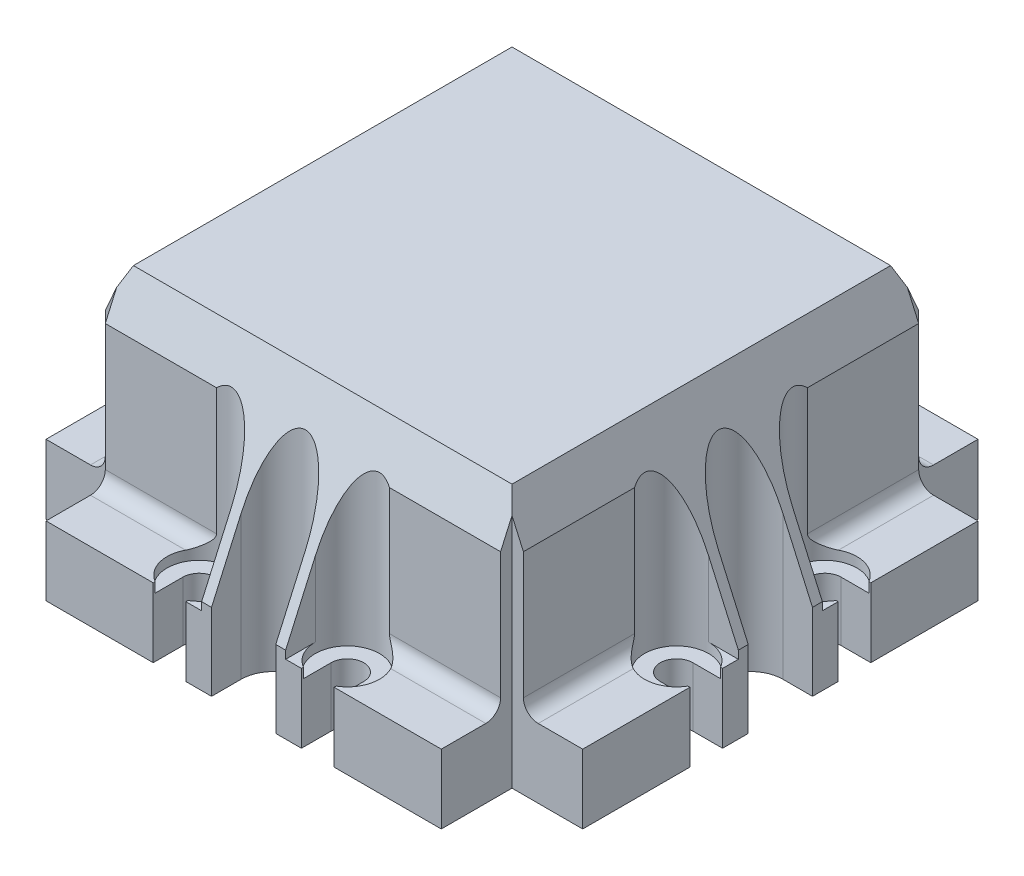
from build123d import *

# Parameters (mm, degrees)
SKETCH1_W            = 40
SKETCH1_H            = 28.8
BOSS_EXTRUDE1_DEPTH  = 11
CHAMFER2_SIZE        = 8
CHAMFER2_SIZE2       = 18
SKETCH10_W           = 13.5
SKETCH10_H           = 18.8
CUT_EXTRUDE7_DEPTH   = 6
FILLET1_R            = 1.5
SKETCH11_W           = 40
SKETCH11_H           = 3
CUT_EXTRUDE8_DEPTH   = 8
CUT_EXTRUDE9_REACH   = 38.748
CUT_EXTRUDE10_DEPTH  = 30.57093174
CUT_EXTRUDE2_DEPTH   = 30
SKETCH15_R           = 3.25
CUT_EXTRUDE12_DEPTH  = 1
CRVPATTERN15_ANGLE   = 90
CRVPATTERN15_2_ANGLE = 90
CRVPATTERN15_3_ANGLE = 180
CUT_EXTRUDE17_DEPTH  = 71.205905928
CUT_EXTRUDE18_DEPTH  = 62.566827448
CUT_EXTRUDE19_DEPTH  = 62.566810271
CUT_EXTRUDE20_DEPTH  = 71.20590591
SKETCH32_W           = 149.475413632
SKETCH32_H           = 198.109954942
CUT_EXTRUDE21_DEPTH  = 3
SKETCH34_W           = 32.310599212
SKETCH34_H           = 32.310599212
BOSS_EXTRUDE4_DEPTH  = 25.8


with BuildPart() as part:
    # Sketch1 → Boss-Extrude1 (new body)
    with BuildSketch(Plane.XY):
        with Locations((0, 14.4)):
            Rectangle(SKETCH1_W, SKETCH1_H)
    extrude(amount=BOSS_EXTRUDE1_DEPTH)

    # Chamfer2
    chamfer2_edges = [part.edges().sort_by_distance(p)[0] for p in [
        (0, 28.8, 11),
    ]]
    chamfer2_side = [part.faces().sort_by_distance(p)[0] for p in [
        (0, 28.8, 5.5),
    ]]
    chamfer(chamfer2_edges, length=CHAMFER2_SIZE, length2=CHAMFER2_SIZE2, reference=chamfer2_side[0])

    # Sketch10 → Cut-Extrude7 (cut)
    with BuildSketch(Plane.XY.offset(11)):
        with Locations((-13.25, 19.4)):
            Rectangle(SKETCH10_W, SKETCH10_H)
        with Locations((13.25, 19.4)):
            Rectangle(SKETCH10_W, SKETCH10_H)
    extrude(amount=-CUT_EXTRUDE7_DEPTH, mode=Mode.SUBTRACT)

    # Fillet1
    fillet1_edges = [part.edges().sort_by_distance(p)[0] for p in [
        (-13.25, 10, 5),
        (13.25, 10, 5),
    ]]
    fillet(fillet1_edges, radius=FILLET1_R)

    # Sketch11 → Cut-Extrude8 (cut)
    with BuildSketch(Plane.XY.offset(11)):
        with Locations((0, 1.5)):
            Rectangle(SKETCH11_W, SKETCH11_H)
    extrude(amount=-CUT_EXTRUDE8_DEPTH, mode=Mode.SUBTRACT)

    # Cut-Extrude9: up to this face of the body (flat: up to its plane)
    cut_extrude9_end = Plane(part.part.faces().sort_by_distance((-13.25, 10, 8.75))[0])
    # Sketch12 → Cut-Extrude9 (cut, up to the picked face)
    with BuildSketch(Plane(origin=(0, 28.8, 0), x_dir=(1, 0, 0), z_dir=(0, 1, 0)), mode=Mode.PRIVATE) as cut_extrude9_sk1:
        with BuildLine():
            Line((-4.25, -8), (-4.25, -11))
            Line((-4.25, -11), (-10.75, -11))
            Line((-10.75, -11), (-10.75, -8))
            ThreePointArc((-10.75, -8), (-7.5, -4.75), (-4.25, -8))
        make_face()
    cut_extrude9_tool1 = split(extrude(cut_extrude9_sk1.sketch, amount=-CUT_EXTRUDE9_REACH, mode=Mode.PRIVATE), bisect_by=cut_extrude9_end, keep=Keep.BOTH, mode=Mode.PRIVATE)
    cut_extrude9 = cut_extrude9_tool1.solids().sort_by(Axis((-7.5, 28.8, 8.176346), (0, -1, 0)))[0]
    add(cut_extrude9, mode=Mode.SUBTRACT)

    # Sketch13 → Cut-Extrude10 (cut, through all)
    with BuildSketch(Plane(origin=(0, 10, 0), x_dir=(1, 0, 0), z_dir=(0, 1, 0))):
        with BuildLine():
            Line((-9.15, -8), (-9.15, -11))
            Line((-9.15, -11), (-5.85, -11))
            Line((-5.85, -11), (-5.85, -8))
            ThreePointArc((-5.85, -8), (-7.5, -6.35), (-9.15, -8))
        make_face()
    cut_extrude10 = extrude(amount=-CUT_EXTRUDE10_DEPTH, mode=Mode.SUBTRACT)

    # Sketch3 → Cut-Extrude2 (cut)
    with BuildSketch(Plane.XZ):
        with BuildLine():
            Line((-3.25, 8), (-3.25, 11))
            Line((-3.25, 11), (3.25, 11))
            Line((3.25, 11), (3.25, 8))
            ThreePointArc((3.25, 8), (0, 4.75), (-3.25, 8))
        make_face()
    extrude(amount=-CUT_EXTRUDE2_DEPTH, mode=Mode.SUBTRACT)

    # Sketch15 → Cut-Extrude12 (cut)
    with BuildSketch(Plane(origin=(0, 10, 0), x_dir=(1, 0, 0), z_dir=(0, 1, 0))):
        with Locations((-7.5, -8)):
            Circle(SKETCH15_R)
    cut_extrude12 = extrude(amount=-CUT_EXTRUDE12_DEPTH, mode=Mode.SUBTRACT)

    # Mirror1: Cut-Extrude9, Cut-Extrude10, Cut-Extrude12 across plane
    add(cut_extrude9.mirror(Plane(origin=(0, 0, 0), x_dir=(0, 0, 1), z_dir=(1, 0, 0))), mode=Mode.SUBTRACT)
    add(cut_extrude10.mirror(Plane(origin=(0, 0, 0), x_dir=(0, 0, 1), z_dir=(1, 0, 0))), mode=Mode.SUBTRACT)
    add(cut_extrude12.mirror(Plane(origin=(0, 0, 0), x_dir=(0, 0, 1), z_dir=(1, 0, 0))), mode=Mode.SUBTRACT)


with BuildPart() as body_2:
    # CrvPattern15: read off the stored shape, not the designer's step
    # CrvPattern15: copy of part
    add(part.part.moved(Location((-16.1552884, 0, 16.1553108))).rotate(Axis((0, 0, 0), (0, -1, 0)), CRVPATTERN15_ANGLE))


with BuildPart() as body_3:
    # CrvPattern15 2: copy of part
    add(part.part.moved(Location((16.1553108, 0, 16.1552884))).rotate(Axis((0, 0, 0), (0, 1, 0)), CRVPATTERN15_2_ANGLE))


with BuildPart() as body_4:
    # CrvPattern15 3: copy of part
    add(part.part.moved(Location((2.24e-05, 0, 32.3105992))).rotate(Axis((0, 0, 0), (0, 1, 0)), CRVPATTERN15_3_ANGLE))


with BuildPart() as cut_extrude17_tool:
    # Sketch28 → Cut-Extrude17 (new, through all)
    with BuildSketch(Plane.ZY.offset(20)):
        Polygon((3, 28.8), (8.248381553, 50.710117836), (5, 24.3), align=None)
    extrude(amount=-CUT_EXTRUDE17_DEPTH)


with BuildPart() as body_2_1:
    add(body_2.part)

    # Cut-Extrude17: cut by cut_extrude17_tool
    add(cut_extrude17_tool.part, mode=Mode.SUBTRACT)


with BuildPart() as body_3_1:
    add(body_3.part)

    # Cut-Extrude17: cut by cut_extrude17_tool
    add(cut_extrude17_tool.part, mode=Mode.SUBTRACT)


with BuildPart() as cut_extrude18_tool:
    # Sketch29 → Cut-Extrude18 (new, through all)
    with BuildSketch(Plane.XY.offset(3.844711608)):
        Polygon((-20, 26.899449344), (-21.15531082, 24.3), (-24.025546184, 30.410559603), (-17.596499578, 32.307325294), align=None)
    extrude(amount=-CUT_EXTRUDE18_DEPTH)


with BuildPart() as part_1:
    add(part.part)

    # Cut-Extrude18: cut by cut_extrude18_tool
    add(cut_extrude18_tool.part, mode=Mode.SUBTRACT)


with BuildPart() as body_4_1:
    add(body_4.part)

    # Cut-Extrude18: cut by cut_extrude18_tool
    add(cut_extrude18_tool.part, mode=Mode.SUBTRACT)


with BuildPart() as cut_extrude19_tool:
    # Sketch30 → Cut-Extrude19 (new, through all)
    with BuildSketch(Plane.XY.offset(3.84468918)):
        Polygon((21.155288392, 24.3), (19.999977573, 26.899449344), (18.296515049, 30.732240022), (23.600824173, 33.089710744), align=None)
    extrude(amount=-CUT_EXTRUDE19_DEPTH)


with BuildPart() as part_2:
    add(part_1.part)

    # Cut-Extrude19: cut by cut_extrude19_tool
    add(cut_extrude19_tool.part, mode=Mode.SUBTRACT)


with BuildPart() as body_4_2:
    add(body_4_1.part)

    # Cut-Extrude19: cut by cut_extrude19_tool
    add(cut_extrude19_tool.part, mode=Mode.SUBTRACT)


with BuildPart() as cut_extrude20_tool:
    # Sketch31 → Cut-Extrude20 (new, through all)
    with BuildSketch(Plane(origin=(19.999977573, 0, 0), x_dir=(0, 0, -1), z_dir=(1, 0, 0))):
        Polygon((36.155288392, 26.899449344), (31.135560458, 38.193837197), (35.352724539, 40.068132344), (39.213228154, 31.381999209), align=None)
    extrude(amount=-CUT_EXTRUDE20_DEPTH)


with BuildPart() as body_2_2:
    add(body_2_1.part)

    # Cut-Extrude20: cut by cut_extrude20_tool
    add(cut_extrude20_tool.part, mode=Mode.SUBTRACT)


with BuildPart() as body_3_2:
    add(body_3_1.part)

    # Cut-Extrude20: cut by cut_extrude20_tool
    add(cut_extrude20_tool.part, mode=Mode.SUBTRACT)


with BuildPart() as cut_extrude21_tool:
    # Sketch32 → Cut-Extrude21 (new body)
    with BuildSketch(Plane.XZ.offset(-3)):
        with Locations((-20.69221841, -55.919702486)):
            Rectangle(SKETCH32_W, SKETCH32_H)
    extrude(amount=CUT_EXTRUDE21_DEPTH)


with BuildPart() as part_3:
    add(part_2.part)

    # Cut-Extrude21: cut by cut_extrude21_tool
    add(cut_extrude21_tool.part, mode=Mode.SUBTRACT)



with BuildPart() as body_2_3:
    add(body_2_2.part)

    # Cut-Extrude21: cut by cut_extrude21_tool
    add(cut_extrude21_tool.part, mode=Mode.SUBTRACT)


with BuildPart() as body_3_3:
    add(body_3_2.part)

    # Cut-Extrude21: cut by cut_extrude21_tool
    add(cut_extrude21_tool.part, mode=Mode.SUBTRACT)


with BuildPart() as body_4_3:
    add(body_4_2.part)

    # Cut-Extrude21: cut by cut_extrude21_tool
    add(cut_extrude21_tool.part, mode=Mode.SUBTRACT)


with BuildPart() as part_4:
    add(part_3.part)

    add(body_2_3.part)  # Boss-Extrude4 merges body 2

    add(body_3_3.part)  # Boss-Extrude4 merges body 3

    add(body_4_3.part)  # Boss-Extrude4 merges body 4
    # Sketch34 → Boss-Extrude4 (add)
    with BuildSketch(Plane.XZ.offset(-3)):
        with Locations((-1.1214e-05, -16.155299606)):
            Rectangle(SKETCH34_W, SKETCH34_H)
    extrude(amount=-BOSS_EXTRUDE4_DEPTH)


solid = part_4.part
